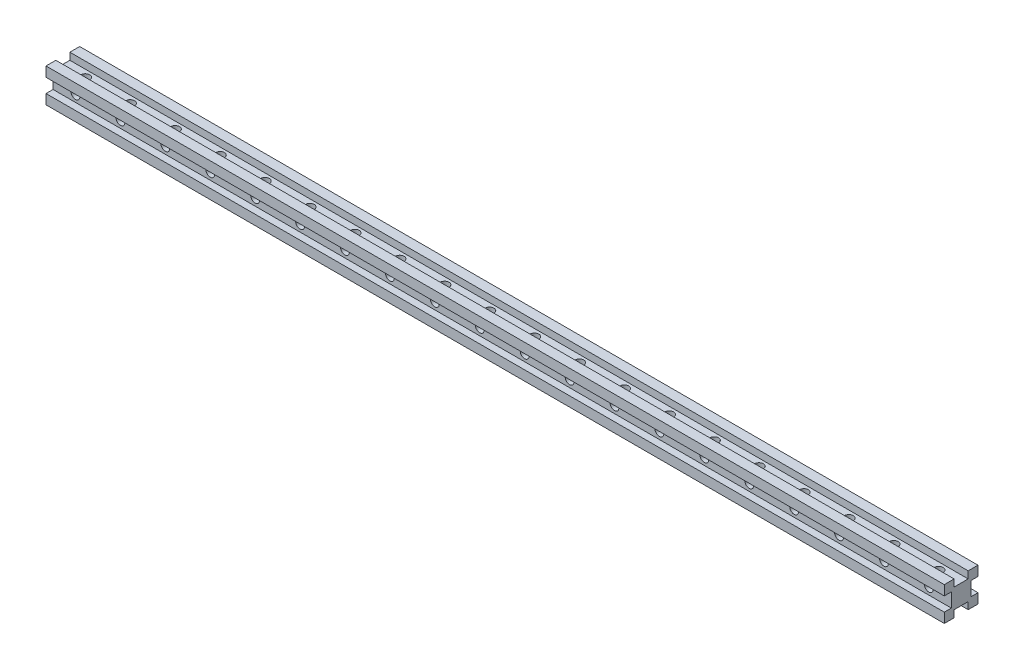
from build123d import *

# Parameters (mm, degrees)
SKETCH1_W             = 19.05
SKETCH1_H             = 19.05
BOSS_EXTRUDE1_DEPTH   = 254
SKETCH3_W             = 2.4892
SKETCH3_H             = 19.05
SKETCH3_AT_POINT_2_W  = 2.4892
SKETCH3_AT_POINT_2_H  = 19.05
LPATTERN1_START       = -11
LPATTERN1_OUTLINE_R   = 2.4892
LPATTERN1_DEPTH       = 22
LPATTERN1_2_OUTLINE_R = 2.4892
LPATTERN1_2_DEPTH     = 22
SKETCH4_W             = 3.96875
SKETCH4_H             = 7.9375
SKETCH4_W_2           = 7.9375
SKETCH4_H_2           = 3.96875
CUT_EXTRUDE1_DEPTH    = 509.178562368


with BuildPart() as part:
    # Sketch1 → Boss-Extrude1 (new, symmetric)
    with BuildSketch(Plane(origin=(0, 0, 0), x_dir=(0, 0, -1), z_dir=(1, 0, 0))):
        Rectangle(SKETCH1_W, SKETCH1_H)
    extrude(amount=BOSS_EXTRUDE1_DEPTH, both=True)

    # Sketch3 → #9 (0.196) Diameter Hole1 (revolve, cut)
    with BuildSketch(Plane(origin=(241.3, 9.525, 0), x_dir=(0, 0, 1), z_dir=(1, 0, 0))):
        with Locations((1.2446, 9.525)):
            Rectangle(SKETCH3_W, SKETCH3_H)
    revolve(axis=Axis((241.3, 15.875, 0), (0, -1, 0)), mode=Mode.SUBTRACT)

    # Sketch3 at point 2 (carried to point 2, square into its face) → #9 (0.196) Diameter Hole1 at 2 (revolve, cut)
    with BuildSketch(Plane(origin=(241.3, 0, 9.525), x_dir=(0, -1, 0), z_dir=(1, 0, 0))):
        with Locations((1.2446, 9.525)):
            Rectangle(SKETCH3_AT_POINT_2_W, SKETCH3_AT_POINT_2_H)
    revolve(axis=Axis((241.3, 0, 15.875), (0, 0, -1)), mode=Mode.SUBTRACT)

    # LPattern1: read off the stored shape, not the designer's step
    # LPattern1 outline → LPattern1 (cut)
    with BuildSketch(Plane.XY.offset(LPATTERN1_START)):
        with Locations((-241.3, 0)):
            Circle(LPATTERN1_OUTLINE_R)
        with Locations((-215.9, 0)):
            Circle(LPATTERN1_OUTLINE_R)
        with Locations((-190.5, 0)):
            Circle(LPATTERN1_OUTLINE_R)
        with Locations((-165.1, 0)):
            Circle(LPATTERN1_OUTLINE_R)
        with Locations((-139.7, 0)):
            Circle(LPATTERN1_OUTLINE_R)
        with Locations((-114.3, 0)):
            Circle(LPATTERN1_OUTLINE_R)
        with Locations((-88.9, 0)):
            Circle(LPATTERN1_OUTLINE_R)
        with Locations((-63.5, 0)):
            Circle(LPATTERN1_OUTLINE_R)
        with Locations((-38.1, 0)):
            Circle(LPATTERN1_OUTLINE_R)
        with Locations((-12.7, 0)):
            Circle(LPATTERN1_OUTLINE_R)
        with Locations((12.7, 0)):
            Circle(LPATTERN1_OUTLINE_R)
        with Locations((38.1, 0)):
            Circle(LPATTERN1_OUTLINE_R)
        with Locations((63.5, 0)):
            Circle(LPATTERN1_OUTLINE_R)
        with Locations((88.9, 0)):
            Circle(LPATTERN1_OUTLINE_R)
        with Locations((114.3, 0)):
            Circle(LPATTERN1_OUTLINE_R)
        with Locations((139.7, 0)):
            Circle(LPATTERN1_OUTLINE_R)
        with Locations((165.1, 0)):
            Circle(LPATTERN1_OUTLINE_R)
        with Locations((190.5, 0)):
            Circle(LPATTERN1_OUTLINE_R)
        with Locations((215.9, 0)):
            Circle(LPATTERN1_OUTLINE_R)
    extrude(amount=LPATTERN1_DEPTH, mode=Mode.SUBTRACT)

    # LPattern1 2 outline → LPattern1 2 (cut)
    with BuildSketch(Plane(origin=(0, 0, 0), x_dir=(1, 0, 0), z_dir=(0, 1, 0)).offset(LPATTERN1_START)):
        with Locations((215.9, 0)):
            Circle(LPATTERN1_2_OUTLINE_R)
        with Locations((190.5, 0)):
            Circle(LPATTERN1_2_OUTLINE_R)
        with Locations((165.1, 0)):
            Circle(LPATTERN1_2_OUTLINE_R)
        with Locations((139.7, 0)):
            Circle(LPATTERN1_2_OUTLINE_R)
        with Locations((114.3, 0)):
            Circle(LPATTERN1_2_OUTLINE_R)
        with Locations((88.9, 0)):
            Circle(LPATTERN1_2_OUTLINE_R)
        with Locations((63.5, 0)):
            Circle(LPATTERN1_2_OUTLINE_R)
        with Locations((38.1, 0)):
            Circle(LPATTERN1_2_OUTLINE_R)
        with Locations((12.7, 0)):
            Circle(LPATTERN1_2_OUTLINE_R)
        with Locations((-12.7, 0)):
            Circle(LPATTERN1_2_OUTLINE_R)
        with Locations((-38.1, 0)):
            Circle(LPATTERN1_2_OUTLINE_R)
        with Locations((-63.5, 0)):
            Circle(LPATTERN1_2_OUTLINE_R)
        with Locations((-88.9, 0)):
            Circle(LPATTERN1_2_OUTLINE_R)
        with Locations((-114.3, 0)):
            Circle(LPATTERN1_2_OUTLINE_R)
        with Locations((-139.7, 0)):
            Circle(LPATTERN1_2_OUTLINE_R)
        with Locations((-165.1, 0)):
            Circle(LPATTERN1_2_OUTLINE_R)
        with Locations((-190.5, 0)):
            Circle(LPATTERN1_2_OUTLINE_R)
        with Locations((-215.9, 0)):
            Circle(LPATTERN1_2_OUTLINE_R)
        with Locations((-241.3, 0)):
            Circle(LPATTERN1_2_OUTLINE_R)
    extrude(amount=LPATTERN1_2_DEPTH, mode=Mode.SUBTRACT)

    # Sketch4 → Cut-Extrude1 (cut, through all)
    with BuildSketch(Plane(origin=(254, 0, 0), x_dir=(0, 0, -1), z_dir=(1, 0, 0))):
        with Locations((-7.540625, 0)):
            Rectangle(SKETCH4_W, SKETCH4_H)
        with Locations((0, 7.540625)):
            Rectangle(SKETCH4_W_2, SKETCH4_H_2)
        with Locations((7.540625, 0)):
            Rectangle(SKETCH4_W, SKETCH4_H)
        with Locations((0, -7.540625)):
            Rectangle(SKETCH4_W_2, SKETCH4_H_2)
    extrude(amount=-CUT_EXTRUDE1_DEPTH, mode=Mode.SUBTRACT)


solid = part.part
